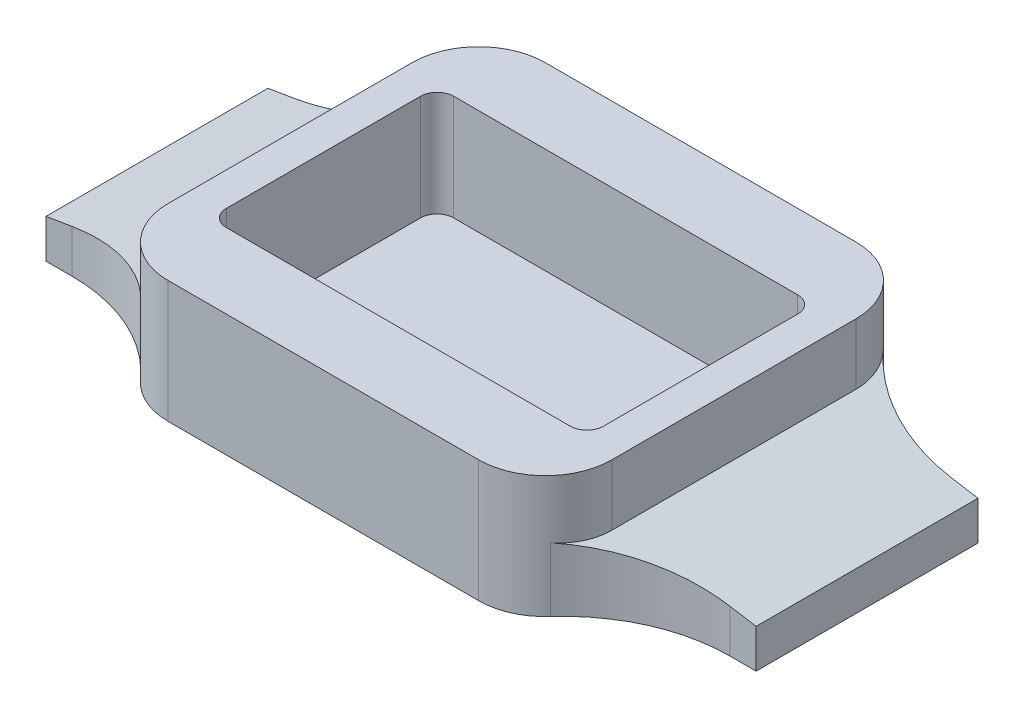
from build123d import *

# Parameters (mm, degrees)
SKETCH1_W           = 40
SKETCH1_H           = 34
BOSS_EXTRUDE1_DEPTH = 11
SKETCH3_W           = 34
SKETCH3_H           = 20.5
CUT_EXTRUDE1_DEPTH  = 9.5
FILLET2_R           = 1.5
BOSS_EXTRUDE3_DEPTH = 10
FILLET3_R           = 6
FILLET4_R           = 15


with BuildPart() as part:
    # Sketch1 → Boss-Extrude1 (new body)
    with BuildSketch(Plane(origin=(0, 0, 0), x_dir=(1, 0, 0), z_dir=(0, 1, 0))):
        with Locations((20, 17)):
            Rectangle(SKETCH1_W, SKETCH1_H)
    extrude(amount=BOSS_EXTRUDE1_DEPTH)

    # Sketch3 → Cut-Extrude1 (cut)
    with BuildSketch(Plane(origin=(0, 11, 0), x_dir=(1, 0, 0), z_dir=(0, 1, 0))):
        with Locations((20, 17)):
            Rectangle(SKETCH3_W, SKETCH3_H)
    extrude(amount=-CUT_EXTRUDE1_DEPTH, mode=Mode.SUBTRACT)

    # Fillet2
    fillet2_edges = [part.edges().sort_by_distance(p)[0] for p in [
        (3, 6.25, -27.25),
        (3, 6.25, -6.75),
        (37, 6.25, -6.75),
        (37, 6.25, -27.25),
    ]]
    fillet(fillet2_edges, radius=FILLET2_R)

    # Sketch5 → Boss-Extrude3 (add, symmetric)
    with BuildSketch(Plane(origin=(0, 0, -17), x_dir=(-1, 0, 0), z_dir=(0, 0, -1))):
        Polygon((-40, 0), (-52, 0), (-52, 3.5), (-40, 5.5), align=None)
        Polygon((12, 3.5), (0, 5.5), (0, 0), (12, 0), align=None)
    extrude(amount=BOSS_EXTRUDE3_DEPTH, both=True)

    # Fillet3
    fillet3_edges = [part.edges().sort_by_distance(p)[0] for p in [
        (0, 5.5, -34),
        (40, 5.5, -34),
        (40, 5.5, 0),
        (0, 5.5, 0),
    ]]
    fillet(fillet3_edges, radius=FILLET3_R)

    # Fillet4
    # the kernel refuses this fillet: 15 mm, written as the material it adds along each edge
    with BuildSketch(Plane(origin=(0, 29.631189606, -27), x_dir=(0.2922336268554167, 0, -0.9563469597039189), z_dir=(0, -1, 0))) as fillet4_piece_1_section:
        with BuildLine():
            CenterArc((11.524426372, -13.614620328), FILLET4_R, 114.818587472, 48.189685104)
            Line((-2.820778024, -9.231115926), (-4.255298463, -8.792765485))
            Line((-4.255298463, -8.792765485), (-1.43452044, 0.43835044))
            Line((-1.43452044, 0.43835044), (0.43835044, 1.43452044))
            ThreePointArc((0.43835044, 1.43452044), (1.3946974, 1.142286813), (4.598608218, 1.361462033))
            Line((4.598608218, 1.361462033), (5.22822805, 0))
        make_face()
    fillet4_piece_1 = extrude(amount=29.631189606, mode=Mode.PRIVATE)
    fillet4_piece_1 = split(fillet4_piece_1, bisect_by=Plane(origin=(-2.592829237, 5.067861794, -27.668863599), z_dir=(0.16439898730535746, -0.9863939238321437, 0)), keep=Keep.TOP, mode=Mode.PRIVATE)
    add(fillet4_piece_1)
    with BuildSketch(Plane(origin=(0, 29.631189606, -7), x_dir=(0.2922336268554167, 0, 0.9563469597039189), z_dir=(0, -1, 0))) as fillet4_piece_2_section:
        with BuildLine():
            CenterArc((11.524426372, 13.614620328), FILLET4_R, 196.991727423, 48.189685104)
            Line((-2.820778024, 9.231115926), (-4.255298463, 8.792765485))
            Line((-4.255298463, 8.792765485), (-1.43452044, -0.43835044))
            Line((-1.43452044, -0.43835044), (0.43835044, -1.43452044))
            ThreePointArc((0.43835044, -1.43452044), (1.3946974, -1.142286813), (4.598608218, -1.361462033))
            Line((4.598608218, -1.361462033), (5.22822805, 0))
        make_face()
    fillet4_piece_2 = extrude(amount=29.631189606, mode=Mode.PRIVATE)
    fillet4_piece_2 = split(fillet4_piece_2, bisect_by=Plane(origin=(-2.592829237, 5.067861794, -6.331136401), z_dir=(0.16439898730535746, -0.9863939238321437, 0)), keep=Keep.TOP, mode=Mode.PRIVATE)
    add(fillet4_piece_2)
    with BuildSketch(Plane(origin=(40, 29.631189606, -7), x_dir=(-0.29223362685541665, 0, 0.9563469597039189), z_dir=(0, -1, 0))) as fillet4_piece_3_section:
        with BuildLine():
            CenterArc((11.524426372, -13.614620328), FILLET4_R, 114.818587472, 48.189685104)
            Line((-2.820778024, -9.231115926), (-4.255298463, -8.792765485))
            Line((-4.255298463, -8.792765485), (-1.43452044, 0.43835044))
            Line((-1.43452044, 0.43835044), (0.43835044, 1.43452044))
            ThreePointArc((0.43835044, 1.43452044), (1.3946974, 1.142286813), (4.598608218, 1.361462033))
            Line((4.598608218, 1.361462033), (5.22822805, 0))
        make_face()
    fillet4_piece_3 = extrude(amount=29.631189606, mode=Mode.PRIVATE)
    fillet4_piece_3 = split(fillet4_piece_3, bisect_by=Plane(origin=(42.592829237, 5.067861794, -6.331136401), z_dir=(-0.16439898730535732, -0.9863939238321437, 0)), keep=Keep.TOP, mode=Mode.PRIVATE)
    add(fillet4_piece_3)
    with BuildSketch(Plane(origin=(40, 29.631189606, -27), x_dir=(-0.2922336268554167, 0, -0.9563469597039189), z_dir=(0, -1, 0))) as fillet4_piece_4_section:
        with BuildLine():
            CenterArc((11.524426372, 13.614620328), FILLET4_R, 196.991727423, 48.189685104)
            Line((-2.820778024, 9.231115926), (-4.255298463, 8.792765485))
            Line((-4.255298463, 8.792765485), (-1.43452044, -0.43835044))
            Line((-1.43452044, -0.43835044), (0.43835044, -1.43452044))
            ThreePointArc((0.43835044, -1.43452044), (1.3946974, -1.142286813), (4.598608218, -1.361462033))
            Line((4.598608218, -1.361462033), (5.22822805, 0))
        make_face()
    fillet4_piece_4 = extrude(amount=29.631189606, mode=Mode.PRIVATE)
    fillet4_piece_4 = split(fillet4_piece_4, bisect_by=Plane(origin=(42.592829237, 5.067861794, -27.668863599), z_dir=(-0.16439898730535732, -0.9863939238321437, 0)), keep=Keep.TOP, mode=Mode.PRIVATE)
    add(fillet4_piece_4)


solid = part.part
